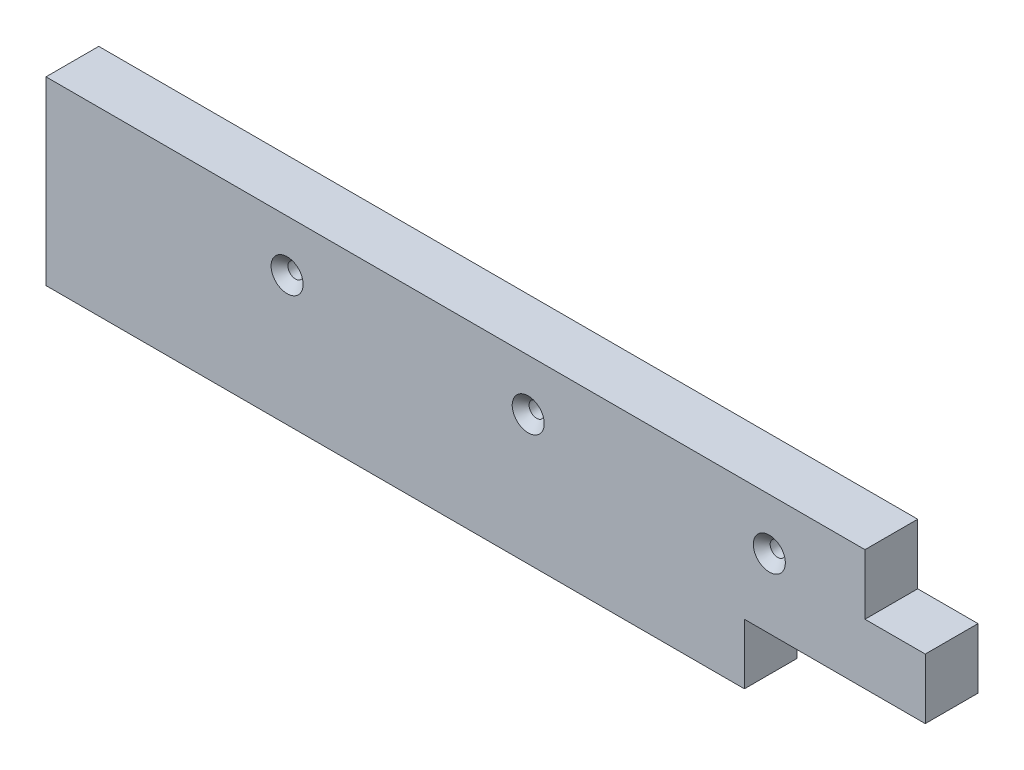
from build123d import *

# Parameters (mm, degrees)
SKETCH1_W                                            = 370.50412818
SKETCH1_H                                            = 22.225
BOSS_EXTRUDE1_DEPTH                                  = 38.1
CSK_FOR_M6_HEX_SOCKET_COUNTERSUNK_HEAD_S_D           = 6.4
CSK_FOR_M6_HEX_SOCKET_COUNTERSUNK_HEAD_S_CSINK_D     = 13.5
CSK_FOR_M6_HEX_SOCKET_COUNTERSUNK_HEAD_S_CSINK_ANGLE = 90
SKETCH3_W                                            = 25.4
SKETCH3_H                                            = 25.4
SKETCH3_W_2                                          = 76.2
CUT_EXTRUDE1_DEPTH                                   = 191.4307955


with BuildPart() as part:
    # Sketch1 → Boss-Extrude1 (new, symmetric)
    with BuildSketch(Plane(origin=(0, 0, 0), x_dir=(1, 0, 0), z_dir=(0, 1, 0))):
        Rectangle(SKETCH1_W, SKETCH1_H)
    extrude(amount=BOSS_EXTRUDE1_DEPTH, both=True)

    # CSK for M6 Hex Socket Countersunk Head Screw6 (through all)
    with Locations(Plane.XY.offset(11.1125)):
        with Locations((-83.652063971, 16.50746), (17.947936029, 16.50746), (119.547936029, 16.50746)):
            CounterSinkHole(CSK_FOR_M6_HEX_SOCKET_COUNTERSUNK_HEAD_S_D / 2, CSK_FOR_M6_HEX_SOCKET_COUNTERSUNK_HEAD_S_CSINK_D / 2, counter_sink_angle=CSK_FOR_M6_HEX_SOCKET_COUNTERSUNK_HEAD_S_CSINK_ANGLE)

    # Sketch3 → Cut-Extrude1 (cut, through all)
    with BuildSketch(Plane.XY.offset(11.1125)):
        with Locations((172.55206409, 25.4)):
            Rectangle(SKETCH3_W, SKETCH3_H)
        with Locations((147.15206409, -25.4)):
            Rectangle(SKETCH3_W_2, SKETCH3_H)
    extrude(amount=-CUT_EXTRUDE1_DEPTH, mode=Mode.SUBTRACT)


solid = part.part
